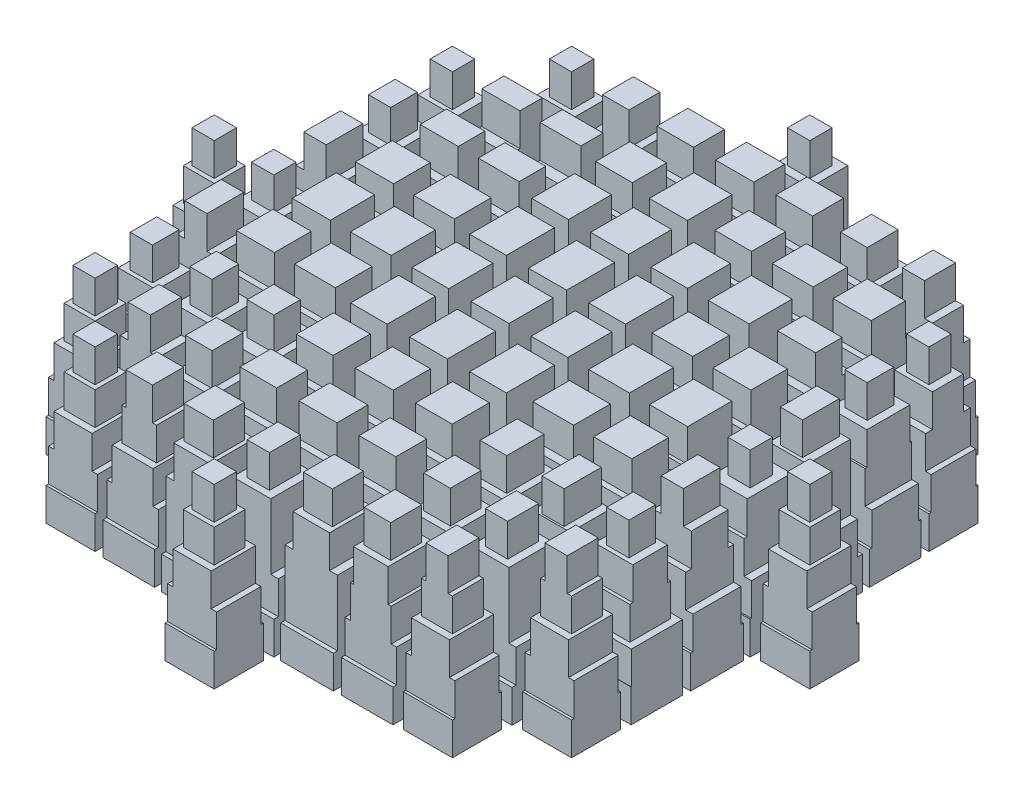
from build123d import *

# Parameters (mm, degrees)
SKETCH1_W           = 380.825028694
SKETCH1_H           = 380.825028694
SKETCH1_W_2         = 380.825028693
SKETCH1_H_2         = 380.825028693
SKETCH1_W_3         = 399.946277384
SKETCH1_H_3         = 399.946277384
SKETCH1_W_4         = 407.866774554
SKETCH1_H_4         = 407.866774554
SKETCH1_W_5         = 413.062739116
SKETCH1_H_5         = 413.062739116
SKETCH1_W_6         = 405.243809891
SKETCH1_H_6         = 405.243809891
SKETCH1_W_7         = 420.736387109
SKETCH1_H_7         = 420.736387109
SKETCH1_W_8         = 430.755323543
SKETCH1_H_8         = 430.755323543
SKETCH1_W_9         = 435.678401371
SKETCH1_H_9         = 435.678401372
SKETCH1_W_10        = 438.119195827
SKETCH1_H_10        = 438.119195827
SKETCH1_W_11        = 447.749339557
SKETCH1_H_11        = 447.749339558
SKETCH1_H_12        = 450.124684288
SKETCH1_W_12        = 447.749339558
SKETCH1_H_13        = 447.749339557
SKETCH1_W_13        = 454.838160301
SKETCH1_H_14        = 454.838160301
SKETCH1_W_14        = 459.503289136
SKETCH1_H_15        = 459.503289136
SKETCH1_W_15        = 435.678401372
SKETCH1_H_16        = 435.678401371
SKETCH1_W_16        = 450.124684288
BOSS_EXTRUDE1_DEPTH = 254
SKETCH2_W           = 380.825028694
SKETCH2_H           = 342.493530132
SKETCH2_W_2         = 380.825028693
SKETCH2_H_2         = 342.493530131
SKETCH2_W_3         = 399.946277384
SKETCH2_H_3         = 287.011536961
SKETCH2_W_4         = 407.866774554
SKETCH2_H_4         = 372.329721467
SKETCH2_W_5         = 413.062739116
SKETCH2_H_5         = 333.608219418
SKETCH2_H_6         = 345.999684769
SKETCH2_W_6         = 405.243809891
SKETCH2_W_7         = 420.736387109
SKETCH2_H_7         = 396.170115437
SKETCH2_W_8         = 430.755323543
SKETCH2_W_9         = 435.678401371
SKETCH2_H_8         = 343.027544271
SKETCH2_W_10        = 438.119195827
SKETCH2_W_11        = 447.749339557
SKETCH2_H_9         = 450.124684288
SKETCH2_H_10        = 447.749339558
SKETCH2_W_12        = 447.749339558
SKETCH2_W_13        = 454.838160301
SKETCH2_W_14        = 459.503289136
SKETCH2_H_11        = 440.990348319
SKETCH2_W_15        = 435.678401372
SKETCH2_W_16        = 450.124684288
SKETCH2_H_12        = 425.775325846
SKETCH2_H_13        = 459.503289136
SKETCH2_H_14        = 375.365303994
SKETCH2_H_15        = 423.263355098
SKETCH2_H_16        = 413.062739116
SKETCH2_H_17        = 409.981511306
SKETCH2_H_18        = 392.971779508
SKETCH2_H_19        = 429.929738033
SKETCH2_H_20        = 332.235530386
SKETCH2_H_21        = 360.691530487
BOSS_EXTRUDE2_DEPTH = 254
SKETCH3_W           = 295.707919328
SKETCH3_H           = 342.493530132
SKETCH3_W_2         = 295.707919329
SKETCH3_H_2         = 342.493530131
SKETCH3_H_3         = 316.606594273
SKETCH3_H_4         = 372.329721467
SKETCH3_H_5         = 333.608219418
SKETCH3_H_6         = 345.999684769
SKETCH3_H_7         = 343.027544271
SKETCH3_W_3         = 316.606594273
SKETCH3_H_8         = 396.170115437
SKETCH3_W_4         = 407.866774554
SKETCH3_W_5         = 450.124684288
SKETCH3_H_9         = 425.775325846
SKETCH3_H_10        = 295.707919328
SKETCH3_H_11        = 423.263355098
SKETCH3_H_12        = 413.062739116
SKETCH3_H_13        = 409.981511306
SKETCH3_H_14        = 392.971779508
SKETCH3_H_15        = 332.235530386
SKETCH3_H_16        = 360.691530487
BOSS_EXTRUDE3_DEPTH = 254
SKETCH4_W           = 239.96776643
SKETCH4_H           = 239.96776643
SKETCH4_H_2         = 239.967766431
SKETCH4_W_2         = 295.707919329
SKETCH4_H_3         = 269.283960235
SKETCH4_H_4         = 284.683846682
SKETCH4_H_5         = 342.493530132
SKETCH4_H_6         = 333.608219418
SKETCH4_W_3         = 239.967766431
SKETCH4_H_7         = 316.606594273
SKETCH4_H_8         = 372.329721467
SKETCH4_H_9         = 345.999684769
SKETCH4_W_4         = 269.283960235
SKETCH4_W_5         = 316.606594273
SKETCH4_H_10        = 342.493530131
SKETCH4_H_11        = 396.170115437
SKETCH4_W_6         = 284.683846682
SKETCH4_H_12        = 343.027544271
SKETCH4_W_7         = 295.707919328
SKETCH4_H_13        = 295.707919328
SKETCH4_H_14        = 413.062739116
SKETCH4_H_15        = 392.971779508
SKETCH4_H_16        = 332.235530386
BOSS_EXTRUDE4_DEPTH = 254
SKETCH5_W           = 172.796541134
SKETCH5_H           = 172.796541134
SKETCH5_W_2         = 172.796541135
SKETCH5_H_2         = 172.796541135
SKETCH5_H_3         = 206.531369558
SKETCH5_H_4         = 284.683846682
SKETCH5_H_5         = 239.967766431
SKETCH5_W_3         = 295.707919329
SKETCH5_H_6         = 342.493530132
SKETCH5_W_4         = 206.531369558
SKETCH5_H_7         = 239.96776643
SKETCH5_W_5         = 316.606594273
SKETCH5_W_6         = 226.243779879
SKETCH5_W_7         = 284.683846682
SKETCH5_H_8         = 288.405362108
SKETCH5_H_9         = 372.329721467
SKETCH5_H_10        = 333.608219418
SKETCH5_H_11        = 265.294347677
SKETCH5_W_8         = 295.707919328
SKETCH5_H_12        = 345.999684769
BOSS_EXTRUDE5_DEPTH = 254
SCALE1_SCALE        = 0.025


with BuildPart() as part:
    # Sketch1 → Boss-Extrude1 (new body)
    with BuildSketch(Plane(origin=(0, 0, 0), x_dir=(1, 0, 0), z_dir=(0, 1, 0))):
        with Locations((-2309.090909091, 0)):
            Rectangle(SKETCH1_W, SKETCH1_H)
        with Locations((-1847.272727273, -1385.454545455)):
            Rectangle(SKETCH1_W_2, SKETCH1_H_2)
        with Locations((-1847.272727273, -923.636363636)):
            Rectangle(SKETCH1_W_3, SKETCH1_H_3)
        with Locations((-1847.272727273, -461.818181818)):
            Rectangle(SKETCH1_W_4, SKETCH1_H_4)
        with Locations((-1847.272727273, 0)):
            Rectangle(SKETCH1_W_5, SKETCH1_H_5)
        with Locations((-1847.272727273, 461.818181818)):
            Rectangle(SKETCH1_W_4, SKETCH1_H_4)
        with Locations((-1847.272727273, 923.636363636)):
            Rectangle(SKETCH1_W_3, SKETCH1_H_3)
        with Locations((-1847.272727273, 1385.454545455)):
            Rectangle(SKETCH1_W_2, SKETCH1_H_2)
        with Locations((-1385.454545455, -1847.272727273)):
            Rectangle(SKETCH1_W_2, SKETCH1_H_2)
        with Locations((-1385.454545455, -1385.454545455)):
            Rectangle(SKETCH1_W_6, SKETCH1_H_6)
        with Locations((-1385.454545455, -923.636363637)):
            Rectangle(SKETCH1_W_7, SKETCH1_H_7)
        with Locations((-1385.454545455, -461.818181819)):
            Rectangle(SKETCH1_W_8, SKETCH1_H_8)
        with Locations((-1385.454545455, 0)):
            Rectangle(SKETCH1_W_9, SKETCH1_H_9)
        with Locations((-1385.454545455, 461.818181819)):
            Rectangle(SKETCH1_W_8, SKETCH1_H_8)
        with Locations((-1385.454545455, 923.636363637)):
            Rectangle(SKETCH1_W_7, SKETCH1_H_7)
        with Locations((-1385.454545455, 1385.454545455)):
            Rectangle(SKETCH1_W_6, SKETCH1_H_6)
        with Locations((-1385.454545455, 1847.272727273)):
            Rectangle(SKETCH1_W_2, SKETCH1_H_2)
        with Locations((-923.636363636, -1847.272727273)):
            Rectangle(SKETCH1_W_3, SKETCH1_H_3)
        with Locations((-923.636363637, -1385.454545455)):
            Rectangle(SKETCH1_W_7, SKETCH1_H_7)
        with Locations((-923.636363636, -923.636363636)):
            Rectangle(SKETCH1_W_10, SKETCH1_H_10)
        with Locations((-923.636363637, -461.818181818)):
            Rectangle(SKETCH1_W_11, SKETCH1_H_11)
        with Locations((-923.636363637, 0)):
            Rectangle(SKETCH1_W_11, SKETCH1_H_12)
        with Locations((-923.636363637, 461.818181818)):
            Rectangle(SKETCH1_W_11, SKETCH1_H_11)
        with Locations((-923.636363636, 923.636363636)):
            Rectangle(SKETCH1_W_10, SKETCH1_H_10)
        with Locations((-923.636363637, 1385.454545455)):
            Rectangle(SKETCH1_W_7, SKETCH1_H_7)
        with Locations((-923.636363636, 1847.272727273)):
            Rectangle(SKETCH1_W_3, SKETCH1_H_3)
        with Locations((-461.818181818, -1847.272727273)):
            Rectangle(SKETCH1_W_4, SKETCH1_H_4)
        with Locations((-461.818181819, -1385.454545455)):
            Rectangle(SKETCH1_W_8, SKETCH1_H_8)
        with Locations((-461.818181818, -923.636363637)):
            Rectangle(SKETCH1_W_12, SKETCH1_H_13)
        with Locations((-461.818181819, -461.818181819)):
            Rectangle(SKETCH1_W_13, SKETCH1_H_14)
        with Locations((-461.818181818, 0)):
            Rectangle(SKETCH1_W_14, SKETCH1_H_15)
        with Locations((-461.818181819, 461.818181819)):
            Rectangle(SKETCH1_W_13, SKETCH1_H_14)
        with Locations((-461.818181818, 923.636363637)):
            Rectangle(SKETCH1_W_12, SKETCH1_H_13)
        with Locations((-461.818181819, 1385.454545455)):
            Rectangle(SKETCH1_W_8, SKETCH1_H_8)
        with Locations((-461.818181818, 1847.272727273)):
            Rectangle(SKETCH1_W_4, SKETCH1_H_4)
        with Locations((0, -2309.090909091)):
            Rectangle(SKETCH1_W, SKETCH1_H)
        with Locations((0, -1847.272727273)):
            Rectangle(SKETCH1_W_5, SKETCH1_H_5)
        with Locations((0, -1385.454545455)):
            Rectangle(SKETCH1_W_15, SKETCH1_H_16)
        with Locations((0, -923.636363637)):
            Rectangle(SKETCH1_W_16, SKETCH1_H_13)
        with Locations((0, -461.818181818)):
            Rectangle(SKETCH1_W_14, SKETCH1_H_15)
        Rectangle(SKETCH1_W_14, SKETCH1_H_15)
        with Locations((0, 461.818181818)):
            Rectangle(SKETCH1_W_14, SKETCH1_H_15)
        with Locations((0, 923.636363637)):
            Rectangle(SKETCH1_W_16, SKETCH1_H_13)
        with Locations((0, 1385.454545455)):
            Rectangle(SKETCH1_W_15, SKETCH1_H_16)
        with Locations((0, 1847.272727273)):
            Rectangle(SKETCH1_W_5, SKETCH1_H_5)
        with Locations((0, 2309.090909091)):
            Rectangle(SKETCH1_W, SKETCH1_H)
        with Locations((461.818181818, -1847.272727273)):
            Rectangle(SKETCH1_W_4, SKETCH1_H_4)
        with Locations((461.818181819, -1385.454545455)):
            Rectangle(SKETCH1_W_8, SKETCH1_H_8)
        with Locations((461.818181818, -923.636363637)):
            Rectangle(SKETCH1_W_12, SKETCH1_H_13)
        with Locations((461.818181819, -461.818181819)):
            Rectangle(SKETCH1_W_13, SKETCH1_H_14)
        with Locations((461.818181818, 0)):
            Rectangle(SKETCH1_W_14, SKETCH1_H_15)
        with Locations((461.818181819, 461.818181819)):
            Rectangle(SKETCH1_W_13, SKETCH1_H_14)
        with Locations((461.818181818, 923.636363637)):
            Rectangle(SKETCH1_W_12, SKETCH1_H_13)
        with Locations((461.818181819, 1385.454545455)):
            Rectangle(SKETCH1_W_8, SKETCH1_H_8)
        with Locations((461.818181818, 1847.272727273)):
            Rectangle(SKETCH1_W_4, SKETCH1_H_4)
        with Locations((923.636363636, -1847.272727273)):
            Rectangle(SKETCH1_W_3, SKETCH1_H_3)
        with Locations((923.636363637, -1385.454545455)):
            Rectangle(SKETCH1_W_7, SKETCH1_H_7)
        with Locations((923.636363636, -923.636363636)):
            Rectangle(SKETCH1_W_10, SKETCH1_H_10)
        with Locations((923.636363637, -461.818181818)):
            Rectangle(SKETCH1_W_11, SKETCH1_H_11)
        with Locations((923.636363637, 0)):
            Rectangle(SKETCH1_W_11, SKETCH1_H_12)
        with Locations((923.636363637, 461.818181818)):
            Rectangle(SKETCH1_W_11, SKETCH1_H_11)
        with Locations((923.636363636, 923.636363636)):
            Rectangle(SKETCH1_W_10, SKETCH1_H_10)
        with Locations((923.636363637, 1385.454545455)):
            Rectangle(SKETCH1_W_7, SKETCH1_H_7)
        with Locations((923.636363636, 1847.272727273)):
            Rectangle(SKETCH1_W_3, SKETCH1_H_3)
        with Locations((1385.454545455, -1847.272727273)):
            Rectangle(SKETCH1_W_2, SKETCH1_H_2)
        with Locations((1385.454545455, -1385.454545455)):
            Rectangle(SKETCH1_W_6, SKETCH1_H_6)
        with Locations((1385.454545455, -923.636363637)):
            Rectangle(SKETCH1_W_7, SKETCH1_H_7)
        with Locations((1385.454545455, -461.818181819)):
            Rectangle(SKETCH1_W_8, SKETCH1_H_8)
        with Locations((1385.454545455, 0)):
            Rectangle(SKETCH1_W_9, SKETCH1_H_9)
        with Locations((1385.454545455, 461.818181819)):
            Rectangle(SKETCH1_W_8, SKETCH1_H_8)
        with Locations((1385.454545455, 923.636363637)):
            Rectangle(SKETCH1_W_7, SKETCH1_H_7)
        with Locations((1385.454545455, 1385.454545455)):
            Rectangle(SKETCH1_W_6, SKETCH1_H_6)
        with Locations((1385.454545455, 1847.272727273)):
            Rectangle(SKETCH1_W_2, SKETCH1_H_2)
        with Locations((1847.272727273, -1385.454545455)):
            Rectangle(SKETCH1_W_2, SKETCH1_H_2)
        with Locations((1847.272727273, -923.636363636)):
            Rectangle(SKETCH1_W_3, SKETCH1_H_3)
        with Locations((1847.272727273, -461.818181818)):
            Rectangle(SKETCH1_W_4, SKETCH1_H_4)
        with Locations((1847.272727273, 0)):
            Rectangle(SKETCH1_W_5, SKETCH1_H_5)
        with Locations((1847.272727273, 461.818181818)):
            Rectangle(SKETCH1_W_4, SKETCH1_H_4)
        with Locations((1847.272727273, 923.636363636)):
            Rectangle(SKETCH1_W_3, SKETCH1_H_3)
        with Locations((1847.272727273, 1385.454545455)):
            Rectangle(SKETCH1_W_2, SKETCH1_H_2)
        with Locations((2309.090909091, 0)):
            Rectangle(SKETCH1_W, SKETCH1_H)
    extrude(amount=BOSS_EXTRUDE1_DEPTH)

    # Sketch2 → Boss-Extrude2 (add)
    with BuildSketch(Plane(origin=(0, 254, 0), x_dir=(1, 0, 0), z_dir=(0, 1, 0))):
        with Locations((-2309.090909091, 0)):
            Rectangle(SKETCH2_W, SKETCH2_H)
        with Locations((-1847.272727273, -1385.454545455)):
            Rectangle(SKETCH2_W_2, SKETCH2_H_2)
        with Locations((-1847.272727273, -923.636363637)):
            Rectangle(SKETCH2_W_3, SKETCH2_H_3)
        with Locations((-1847.272727273, -461.818181819)):
            Rectangle(SKETCH2_W_4, SKETCH2_H_4)
        with Locations((-1847.272727273, 0)):
            Rectangle(SKETCH2_W_5, SKETCH2_H)
        with Locations((-1847.272727273, 461.818181819)):
            Rectangle(SKETCH2_W_4, SKETCH2_H_4)
        with Locations((-1847.272727273, 923.636363636)):
            Rectangle(SKETCH2_W_3, SKETCH2_H_5)
        with Locations((-1847.272727273, 1385.454545455)):
            Rectangle(SKETCH2_W_2, SKETCH2_H_6)
        with Locations((-1385.454545455, -1847.272727273)):
            Rectangle(SKETCH2_W_2, SKETCH2_H_2)
        with Locations((-1385.454545455, -1385.454545455)):
            Rectangle(SKETCH2_W_6, SKETCH2_H_2)
        with Locations((-1385.454545455, -923.636363637)):
            Rectangle(SKETCH2_W_7, SKETCH2_H_7)
        with Locations((-1385.454545455, -461.818181819)):
            Rectangle(SKETCH2_W_8, SKETCH2_H_4)
        with Locations((-1385.454545455, 0)):
            Rectangle(SKETCH2_W_9, SKETCH2_H)
        with Locations((-1385.454545455, 461.818181819)):
            Rectangle(SKETCH2_W_8, SKETCH2_H_4)
        with Locations((-1385.454545455, 923.636363636)):
            Rectangle(SKETCH2_W_7, SKETCH2_H_5)
        with Locations((-1385.454545455, 1385.454545455)):
            Rectangle(SKETCH2_W_6, SKETCH2_H_6)
        with Locations((-1385.454545455, 1847.272727273)):
            Rectangle(SKETCH2_W_2, SKETCH2_H_8)
        with Locations((-923.636363636, -1847.272727273)):
            Rectangle(SKETCH2_W_3, SKETCH2_H_2)
        with Locations((-923.636363637, -1385.454545455)):
            Rectangle(SKETCH2_W_7, SKETCH2_H_2)
        with Locations((-923.636363636, -923.636363637)):
            Rectangle(SKETCH2_W_10, SKETCH2_H_7)
        with Locations((-923.636363637, -461.818181819)):
            Rectangle(SKETCH2_W_11, SKETCH2_H_4)
        with Locations((-923.636363637, 0)):
            Rectangle(SKETCH2_W_11, SKETCH2_H_9)
        with Locations((-923.636363637, 461.818181818)):
            Rectangle(SKETCH2_W_11, SKETCH2_H_10)
        with Locations((-923.636363636, 923.636363636)):
            Rectangle(SKETCH2_W_10, SKETCH2_H_5)
        with Locations((-923.636363637, 1385.454545455)):
            Rectangle(SKETCH2_W_7, SKETCH2_H_6)
        with Locations((-923.636363636, 1847.272727273)):
            Rectangle(SKETCH2_W_3, SKETCH2_H_8)
        with Locations((-461.818181818, -1847.272727273)):
            Rectangle(SKETCH2_W_4, SKETCH2_H_2)
        with Locations((-461.818181819, -1385.454545455)):
            Rectangle(SKETCH2_W_8, SKETCH2_H_2)
        with Locations((-461.818181818, -923.636363637)):
            Rectangle(SKETCH2_W_12, SKETCH2_H_7)
        with Locations((-461.818181819, -461.818181819)):
            Rectangle(SKETCH2_W_13, SKETCH2_H_4)
        with Locations((-461.818181818, 0)):
            Rectangle(SKETCH2_W_14, SKETCH2_H_9)
        with Locations((-461.818181819, 461.818181818)):
            Rectangle(SKETCH2_W_13, SKETCH2_H_10)
        with Locations((-461.818181818, 923.636363636)):
            Rectangle(SKETCH2_W_12, SKETCH2_H_11)
        with Locations((-461.818181819, 1385.454545455)):
            Rectangle(SKETCH2_W_8, SKETCH2_H_6)
        with Locations((-461.818181818, 1847.272727273)):
            Rectangle(SKETCH2_W_4, SKETCH2_H_8)
        with Locations((0, -2309.090909091)):
            Rectangle(SKETCH2_W, SKETCH2_H)
        with Locations((0, -1847.272727273)):
            Rectangle(SKETCH2_W_5, SKETCH2_H_2)
        with Locations((0, -1385.454545455)):
            Rectangle(SKETCH2_W_15, SKETCH2_H_2)
        with Locations((0, -923.636363637)):
            Rectangle(SKETCH2_W_16, SKETCH2_H_7)
        with Locations((0, -461.818181818)):
            Rectangle(SKETCH2_W_14, SKETCH2_H_12)
        Rectangle(SKETCH2_W_14, SKETCH2_H_9)
        with Locations((0, 461.818181818)):
            Rectangle(SKETCH2_W_14, SKETCH2_H_13)
        with Locations((0, 923.636363636)):
            Rectangle(SKETCH2_W_16, SKETCH2_H_11)
        with Locations((0, 1385.454545455)):
            Rectangle(SKETCH2_W_15, SKETCH2_H_6)
        with Locations((0, 1847.272727273)):
            Rectangle(SKETCH2_W_5, SKETCH2_H_8)
        with Locations((0, 2309.090909091)):
            Rectangle(SKETCH2_W, SKETCH2_H_14)
        with Locations((461.818181818, -1847.272727273)):
            Rectangle(SKETCH2_W_4, SKETCH2_H_2)
        with Locations((461.818181819, -1385.454545455)):
            Rectangle(SKETCH2_W_8, SKETCH2_H_2)
        with Locations((461.818181818, -923.636363637)):
            Rectangle(SKETCH2_W_12, SKETCH2_H_7)
        with Locations((461.818181819, -461.818181818)):
            Rectangle(SKETCH2_W_13, SKETCH2_H_12)
        with Locations((461.818181818, 0)):
            Rectangle(SKETCH2_W_14, SKETCH2_H_9)
        with Locations((461.818181819, 461.818181818)):
            Rectangle(SKETCH2_W_13, SKETCH2_H_15)
        with Locations((461.818181818, 923.636363636)):
            Rectangle(SKETCH2_W_12, SKETCH2_H_11)
        with Locations((461.818181819, 1385.454545455)):
            Rectangle(SKETCH2_W_8, SKETCH2_H_6)
        with Locations((461.818181818, 1847.272727273)):
            Rectangle(SKETCH2_W_4, SKETCH2_H_8)
        with Locations((923.636363636, -1847.272727273)):
            Rectangle(SKETCH2_W_3, SKETCH2_H_2)
        with Locations((923.636363637, -1385.454545455)):
            Rectangle(SKETCH2_W_7, SKETCH2_H_2)
        with Locations((923.636363636, -923.636363637)):
            Rectangle(SKETCH2_W_10, SKETCH2_H_7)
        with Locations((923.636363637, -461.818181818)):
            Rectangle(SKETCH2_W_11, SKETCH2_H_16)
        with Locations((923.636363637, 0)):
            Rectangle(SKETCH2_W_11, SKETCH2_H_9)
        with Locations((923.636363637, 461.818181818)):
            Rectangle(SKETCH2_W_11, SKETCH2_H_10)
        with Locations((923.636363636, 923.636363636)):
            Rectangle(SKETCH2_W_10, SKETCH2_H_17)
        with Locations((923.636363637, 1385.454545455)):
            Rectangle(SKETCH2_W_7, SKETCH2_H_6)
        with Locations((923.636363636, 1847.272727273)):
            Rectangle(SKETCH2_W_3, SKETCH2_H_8)
        with Locations((1385.454545455, -1847.272727273)):
            Rectangle(SKETCH2_W_2, SKETCH2_H_2)
        with Locations((1385.454545455, -1385.454545455)):
            Rectangle(SKETCH2_W_6, SKETCH2_H_2)
        with Locations((1385.454545455, -923.636363637)):
            Rectangle(SKETCH2_W_7, SKETCH2_H_7)
        with Locations((1385.454545455, -461.818181818)):
            Rectangle(SKETCH2_W_8, SKETCH2_H_16)
        with Locations((1385.454545455, 0)):
            Rectangle(SKETCH2_W_9, SKETCH2_H_18)
        with Locations((1385.454545455, 461.818181819)):
            Rectangle(SKETCH2_W_8, SKETCH2_H_19)
        with Locations((1385.454545455, 923.636363636)):
            Rectangle(SKETCH2_W_7, SKETCH2_H_17)
        with Locations((1385.454545455, 1385.454545455)):
            Rectangle(SKETCH2_W_6, SKETCH2_H_6)
        with Locations((1385.454545455, 1847.272727273)):
            Rectangle(SKETCH2_W_2, SKETCH2_H_8)
        with Locations((1847.272727273, -1385.454545455)):
            Rectangle(SKETCH2_W_2, SKETCH2_H_2)
        with Locations((1847.272727273, -923.636363637)):
            Rectangle(SKETCH2_W_3, SKETCH2_H_7)
        with Locations((1847.272727273, -461.818181819)):
            Rectangle(SKETCH2_W_4, SKETCH2_H_4)
        with Locations((1847.272727273, 0)):
            Rectangle(SKETCH2_W_5, SKETCH2_H_18)
        with Locations((1847.272727273, 461.818181818)):
            Rectangle(SKETCH2_W_4, SKETCH2_H_20)
        with Locations((1847.272727273, 923.636363637)):
            Rectangle(SKETCH2_W_3, SKETCH2_H_21)
        with Locations((1847.272727273, 1385.454545455)):
            Rectangle(SKETCH2_W_2, SKETCH2_H_6)
        with Locations((2309.090909091, 0)):
            Rectangle(SKETCH2_W, SKETCH2_H)
    extrude(amount=BOSS_EXTRUDE2_DEPTH)

    # Sketch3 → Boss-Extrude3 (add)
    with BuildSketch(Plane(origin=(0, 508, 0), x_dir=(1, 0, 0), z_dir=(0, 1, 0))):
        with Locations((-2309.090909091, 0)):
            Rectangle(SKETCH3_W, SKETCH3_H)
        with Locations((-1847.272727273, -1385.454545455)):
            Rectangle(SKETCH3_W_2, SKETCH3_H_2)
        with Locations((-1847.272727273, -923.636363637)):
            Rectangle(SKETCH3_W_2, SKETCH3_H_3)
        with Locations((-1847.272727273, -461.818181819)):
            Rectangle(SKETCH3_W_2, SKETCH3_H_4)
        with Locations((-1847.272727273, 0)):
            Rectangle(SKETCH3_W_2, SKETCH3_H)
        with Locations((-1847.272727273, 461.818181819)):
            Rectangle(SKETCH3_W_2, SKETCH3_H_4)
        with Locations((-1847.272727273, 923.636363636)):
            Rectangle(SKETCH3_W_2, SKETCH3_H_5)
        with Locations((-1847.272727273, 1385.454545455)):
            Rectangle(SKETCH3_W_2, SKETCH3_H_6)
        with Locations((-1385.454545455, -1847.272727273)):
            Rectangle(SKETCH3_W_2, SKETCH3_H_2)
        with Locations((-1385.454545455, -1385.454545455)):
            Rectangle(SKETCH3_W_2, SKETCH3_H_2)
        with Locations((-1385.454545455, -923.636363637)):
            Rectangle(SKETCH3_W_2, SKETCH3_H_3)
        with Locations((-1385.454545455, -461.818181819)):
            Rectangle(SKETCH3_W_2, SKETCH3_H_4)
        with Locations((-1385.454545455, 0)):
            Rectangle(SKETCH3_W_2, SKETCH3_H)
        with Locations((-1385.454545455, 461.818181819)):
            Rectangle(SKETCH3_W_2, SKETCH3_H_4)
        with Locations((-1385.454545455, 923.636363636)):
            Rectangle(SKETCH3_W_2, SKETCH3_H_5)
        with Locations((-1385.454545455, 1385.454545455)):
            Rectangle(SKETCH3_W_2, SKETCH3_H_6)
        with Locations((-1385.454545455, 1847.272727273)):
            Rectangle(SKETCH3_W_2, SKETCH3_H_7)
        with Locations((-923.636363637, -1847.272727273)):
            Rectangle(SKETCH3_W_3, SKETCH3_H_2)
        with Locations((-923.636363637, -1385.454545455)):
            Rectangle(SKETCH3_W_3, SKETCH3_H_2)
        with Locations((-923.636363637, -923.636363637)):
            Rectangle(SKETCH3_W_3, SKETCH3_H_8)
        with Locations((-923.636363637, -461.818181819)):
            Rectangle(SKETCH3_W_3, SKETCH3_H_4)
        with Locations((-923.636363637, 0)):
            Rectangle(SKETCH3_W_3, SKETCH3_H)
        with Locations((-923.636363637, 461.818181819)):
            Rectangle(SKETCH3_W_3, SKETCH3_H_4)
        with Locations((-923.636363637, 923.636363636)):
            Rectangle(SKETCH3_W_3, SKETCH3_H_5)
        with Locations((-923.636363637, 1385.454545455)):
            Rectangle(SKETCH3_W_3, SKETCH3_H_6)
        with Locations((-923.636363637, 1847.272727273)):
            Rectangle(SKETCH3_W_3, SKETCH3_H_7)
        with Locations((-461.818181818, -1847.272727273)):
            Rectangle(SKETCH3_W_4, SKETCH3_H_2)
        with Locations((-461.818181818, -1385.454545455)):
            Rectangle(SKETCH3_W_4, SKETCH3_H_2)
        with Locations((-461.818181818, -923.636363637)):
            Rectangle(SKETCH3_W_4, SKETCH3_H_8)
        with Locations((-461.818181818, -461.818181819)):
            Rectangle(SKETCH3_W_4, SKETCH3_H_4)
        with Locations((-461.818181818, 0)):
            Rectangle(SKETCH3_W_4, SKETCH3_H)
        with Locations((-461.818181818, 461.818181819)):
            Rectangle(SKETCH3_W_4, SKETCH3_H_4)
        with Locations((-461.818181818, 923.636363636)):
            Rectangle(SKETCH3_W_4, SKETCH3_H_5)
        with Locations((-461.818181818, 1385.454545455)):
            Rectangle(SKETCH3_W_4, SKETCH3_H_6)
        with Locations((-461.818181818, 1847.272727273)):
            Rectangle(SKETCH3_W_4, SKETCH3_H_7)
        with Locations((0, -2309.090909091)):
            Rectangle(SKETCH3_W, SKETCH3_H)
        with Locations((0, -1847.272727273)):
            Rectangle(SKETCH3_W, SKETCH3_H_2)
        with Locations((0, -1385.454545455)):
            Rectangle(SKETCH3_W, SKETCH3_H_2)
        with Locations((0, -923.636363637)):
            Rectangle(SKETCH3_W_5, SKETCH3_H_8)
        with Locations((0, -461.818181818)):
            Rectangle(SKETCH3_W_5, SKETCH3_H_9)
        Rectangle(SKETCH3_W_5, SKETCH3_H)
        with Locations((0, 461.818181819)):
            Rectangle(SKETCH3_W_5, SKETCH3_H_4)
        with Locations((0, 923.636363636)):
            Rectangle(SKETCH3_W_5, SKETCH3_H_5)
        with Locations((0, 1385.454545455)):
            Rectangle(SKETCH3_W, SKETCH3_H_6)
        with Locations((0, 1847.272727273)):
            Rectangle(SKETCH3_W, SKETCH3_H_7)
        with Locations((0, 2309.090909091)):
            Rectangle(SKETCH3_W, SKETCH3_H_10)
        with Locations((461.818181818, -1847.272727273)):
            Rectangle(SKETCH3_W_4, SKETCH3_H_2)
        with Locations((461.818181818, -1385.454545455)):
            Rectangle(SKETCH3_W_4, SKETCH3_H_2)
        with Locations((461.818181818, -923.636363637)):
            Rectangle(SKETCH3_W_4, SKETCH3_H_8)
        with Locations((461.818181818, -461.818181818)):
            Rectangle(SKETCH3_W_4, SKETCH3_H_9)
        with Locations((461.818181818, 0)):
            Rectangle(SKETCH3_W_4, SKETCH3_H)
        with Locations((461.818181818, 461.818181818)):
            Rectangle(SKETCH3_W_4, SKETCH3_H_11)
        with Locations((461.818181818, 923.636363636)):
            Rectangle(SKETCH3_W_4, SKETCH3_H_5)
        with Locations((461.818181818, 1385.454545455)):
            Rectangle(SKETCH3_W_4, SKETCH3_H_6)
        with Locations((461.818181818, 1847.272727273)):
            Rectangle(SKETCH3_W_4, SKETCH3_H_7)
        with Locations((923.636363637, -1847.272727273)):
            Rectangle(SKETCH3_W_3, SKETCH3_H_2)
        with Locations((923.636363637, -1385.454545455)):
            Rectangle(SKETCH3_W_3, SKETCH3_H_2)
        with Locations((923.636363637, -923.636363637)):
            Rectangle(SKETCH3_W_3, SKETCH3_H_8)
        with Locations((923.636363637, -461.818181818)):
            Rectangle(SKETCH3_W_3, SKETCH3_H_12)
        with Locations((923.636363637, 0)):
            Rectangle(SKETCH3_W_3, SKETCH3_H)
        with Locations((923.636363637, 461.818181818)):
            Rectangle(SKETCH3_W_3, SKETCH3_H_11)
        with Locations((923.636363637, 923.636363636)):
            Rectangle(SKETCH3_W_3, SKETCH3_H_13)
        with Locations((923.636363637, 1385.454545455)):
            Rectangle(SKETCH3_W_3, SKETCH3_H_6)
        with Locations((923.636363637, 1847.272727273)):
            Rectangle(SKETCH3_W_3, SKETCH3_H_7)
        with Locations((1385.454545455, -1847.272727273)):
            Rectangle(SKETCH3_W_2, SKETCH3_H_2)
        with Locations((1385.454545455, -1385.454545455)):
            Rectangle(SKETCH3_W_2, SKETCH3_H_2)
        with Locations((1385.454545455, -923.636363637)):
            Rectangle(SKETCH3_W_2, SKETCH3_H_8)
        with Locations((1385.454545455, -461.818181818)):
            Rectangle(SKETCH3_W_2, SKETCH3_H_12)
        with Locations((1385.454545455, 0)):
            Rectangle(SKETCH3_W_2, SKETCH3_H_14)
        with Locations((1385.454545455, 461.818181818)):
            Rectangle(SKETCH3_W_2, SKETCH3_H_11)
        with Locations((1385.454545455, 923.636363636)):
            Rectangle(SKETCH3_W_2, SKETCH3_H_13)
        with Locations((1385.454545455, 1385.454545455)):
            Rectangle(SKETCH3_W_2, SKETCH3_H_6)
        with Locations((1385.454545455, 1847.272727273)):
            Rectangle(SKETCH3_W_2, SKETCH3_H_7)
        with Locations((1847.272727273, -1385.454545455)):
            Rectangle(SKETCH3_W_2, SKETCH3_H_2)
        with Locations((1847.272727273, -923.636363637)):
            Rectangle(SKETCH3_W_2, SKETCH3_H_3)
        with Locations((1847.272727273, -461.818181819)):
            Rectangle(SKETCH3_W_2, SKETCH3_H_4)
        with Locations((1847.272727273, 0)):
            Rectangle(SKETCH3_W_2, SKETCH3_H_14)
        with Locations((1847.272727273, 461.818181818)):
            Rectangle(SKETCH3_W_2, SKETCH3_H_15)
        with Locations((1847.272727273, 923.636363637)):
            Rectangle(SKETCH3_W_2, SKETCH3_H_16)
        with Locations((1847.272727273, 1385.454545455)):
            Rectangle(SKETCH3_W_2, SKETCH3_H_6)
        with Locations((2309.090909091, 0)):
            Rectangle(SKETCH3_W, SKETCH3_H)
    extrude(amount=BOSS_EXTRUDE3_DEPTH)

    # Sketch4 → Boss-Extrude4 (add)
    with BuildSketch(Plane(origin=(0, 762, 0), x_dir=(1, 0, 0), z_dir=(0, 1, 0))):
        with Locations((-2309.090909091, 0)):
            Rectangle(SKETCH4_W, SKETCH4_H)
        with Locations((-1847.272727273, -1385.454545455)):
            Rectangle(SKETCH4_W, SKETCH4_H_2)
        with Locations((-1847.272727273, -923.636363637)):
            Rectangle(SKETCH4_W_2, SKETCH4_H_3)
        with Locations((-1847.272727273, -461.818181818)):
            Rectangle(SKETCH4_W_2, SKETCH4_H_4)
        with Locations((-1847.272727273, 0)):
            Rectangle(SKETCH4_W_2, SKETCH4_H_5)
        with Locations((-1847.272727273, 461.818181818)):
            Rectangle(SKETCH4_W_2, SKETCH4_H_4)
        with Locations((-1847.272727273, 923.636363636)):
            Rectangle(SKETCH4_W_2, SKETCH4_H_6)
        with Locations((-1847.272727273, 1385.454545455)):
            Rectangle(SKETCH4_W_2, SKETCH4_H_2)
        with Locations((-1385.454545455, -1847.272727273)):
            Rectangle(SKETCH4_W_3, SKETCH4_H)
        with Locations((-1385.454545455, -1385.454545455)):
            Rectangle(SKETCH4_W_2, SKETCH4_H_2)
        with Locations((-1385.454545455, -923.636363637)):
            Rectangle(SKETCH4_W_2, SKETCH4_H_7)
        with Locations((-1385.454545455, -461.818181819)):
            Rectangle(SKETCH4_W_2, SKETCH4_H_8)
        with Locations((-1385.454545455, 0)):
            Rectangle(SKETCH4_W_2, SKETCH4_H_5)
        with Locations((-1385.454545455, 461.818181819)):
            Rectangle(SKETCH4_W_2, SKETCH4_H_8)
        with Locations((-1385.454545455, 923.636363636)):
            Rectangle(SKETCH4_W_2, SKETCH4_H_6)
        with Locations((-1385.454545455, 1385.454545455)):
            Rectangle(SKETCH4_W_2, SKETCH4_H_9)
        with Locations((-1385.454545455, 1847.272727273)):
            Rectangle(SKETCH4_W_2, SKETCH4_H)
        with Locations((-923.636363637, -1847.272727273)):
            Rectangle(SKETCH4_W_4, SKETCH4_H)
        with Locations((-923.636363637, -1385.454545455)):
            Rectangle(SKETCH4_W_5, SKETCH4_H_10)
        with Locations((-923.636363637, -923.636363637)):
            Rectangle(SKETCH4_W_5, SKETCH4_H_11)
        with Locations((-923.636363637, -461.818181819)):
            Rectangle(SKETCH4_W_5, SKETCH4_H_8)
        with Locations((-923.636363637, 0)):
            Rectangle(SKETCH4_W_5, SKETCH4_H_5)
        with Locations((-923.636363637, 461.818181819)):
            Rectangle(SKETCH4_W_5, SKETCH4_H_8)
        with Locations((-923.636363637, 923.636363636)):
            Rectangle(SKETCH4_W_5, SKETCH4_H_6)
        with Locations((-923.636363637, 1385.454545455)):
            Rectangle(SKETCH4_W_5, SKETCH4_H_9)
        with Locations((-923.636363637, 1847.272727273)):
            Rectangle(SKETCH4_W_5, SKETCH4_H)
        with Locations((-461.818181818, -1847.272727273)):
            Rectangle(SKETCH4_W_6, SKETCH4_H_10)
        with Locations((-461.818181818, -1385.454545455)):
            Rectangle(SKETCH4_W_6, SKETCH4_H_10)
        with Locations((-461.818181818, -923.636363637)):
            Rectangle(SKETCH4_W_6, SKETCH4_H_11)
        with Locations((-461.818181818, -461.818181819)):
            Rectangle(SKETCH4_W_6, SKETCH4_H_8)
        with Locations((-461.818181818, 0)):
            Rectangle(SKETCH4_W_6, SKETCH4_H_5)
        with Locations((-461.818181818, 461.818181819)):
            Rectangle(SKETCH4_W_6, SKETCH4_H_8)
        with Locations((-461.818181818, 923.636363636)):
            Rectangle(SKETCH4_W_6, SKETCH4_H_6)
        with Locations((-461.818181818, 1385.454545455)):
            Rectangle(SKETCH4_W_6, SKETCH4_H_9)
        with Locations((-461.818181818, 1847.272727273)):
            Rectangle(SKETCH4_W_6, SKETCH4_H_12)
        with Locations((0, -2309.090909091)):
            Rectangle(SKETCH4_W, SKETCH4_H)
        with Locations((0, -1847.272727273)):
            Rectangle(SKETCH4_W_7, SKETCH4_H_10)
        with Locations((0, -1385.454545455)):
            Rectangle(SKETCH4_W_7, SKETCH4_H_10)
        with Locations((0, -923.636363637)):
            Rectangle(SKETCH4_W_7, SKETCH4_H_11)
        with Locations((0, -461.818181819)):
            Rectangle(SKETCH4_W_7, SKETCH4_H_8)
        Rectangle(SKETCH4_W_7, SKETCH4_H_5)
        with Locations((0, 461.818181819)):
            Rectangle(SKETCH4_W_7, SKETCH4_H_8)
        with Locations((0, 923.636363636)):
            Rectangle(SKETCH4_W_7, SKETCH4_H_6)
        with Locations((0, 1385.454545455)):
            Rectangle(SKETCH4_W_7, SKETCH4_H_9)
        with Locations((0, 1847.272727273)):
            Rectangle(SKETCH4_W_7, SKETCH4_H_12)
        with Locations((0, 2309.090909091)):
            Rectangle(SKETCH4_W_7, SKETCH4_H_13)
        with Locations((461.818181818, -1847.272727273)):
            Rectangle(SKETCH4_W_6, SKETCH4_H_10)
        with Locations((461.818181818, -1385.454545455)):
            Rectangle(SKETCH4_W_6, SKETCH4_H_10)
        with Locations((461.818181818, -923.636363637)):
            Rectangle(SKETCH4_W_6, SKETCH4_H_11)
        with Locations((461.818181818, -461.818181819)):
            Rectangle(SKETCH4_W_6, SKETCH4_H_8)
        with Locations((461.818181818, 0)):
            Rectangle(SKETCH4_W_6, SKETCH4_H_5)
        with Locations((461.818181818, 461.818181819)):
            Rectangle(SKETCH4_W_6, SKETCH4_H_8)
        with Locations((461.818181818, 923.636363636)):
            Rectangle(SKETCH4_W_6, SKETCH4_H_6)
        with Locations((461.818181818, 1385.454545455)):
            Rectangle(SKETCH4_W_6, SKETCH4_H_9)
        with Locations((461.818181818, 1847.272727273)):
            Rectangle(SKETCH4_W_6, SKETCH4_H_12)
        with Locations((923.636363637, -1847.272727273)):
            Rectangle(SKETCH4_W_4, SKETCH4_H_10)
        with Locations((923.636363637, -1385.454545455)):
            Rectangle(SKETCH4_W_5, SKETCH4_H_10)
        with Locations((923.636363637, -923.636363637)):
            Rectangle(SKETCH4_W_5, SKETCH4_H_11)
        with Locations((923.636363637, -461.818181818)):
            Rectangle(SKETCH4_W_5, SKETCH4_H_14)
        with Locations((923.636363637, 0)):
            Rectangle(SKETCH4_W_5, SKETCH4_H_5)
        with Locations((923.636363637, 461.818181819)):
            Rectangle(SKETCH4_W_5, SKETCH4_H_8)
        with Locations((923.636363637, 923.636363636)):
            Rectangle(SKETCH4_W_5, SKETCH4_H_6)
        with Locations((923.636363637, 1385.454545455)):
            Rectangle(SKETCH4_W_5, SKETCH4_H_9)
        with Locations((923.636363637, 1847.272727273)):
            Rectangle(SKETCH4_W_5, SKETCH4_H_12)
        with Locations((1385.454545455, -1847.272727273)):
            Rectangle(SKETCH4_W_3, SKETCH4_H)
        with Locations((1385.454545455, -1385.454545455)):
            Rectangle(SKETCH4_W_2, SKETCH4_H_10)
        with Locations((1385.454545455, -923.636363637)):
            Rectangle(SKETCH4_W_2, SKETCH4_H_7)
        with Locations((1385.454545455, -461.818181819)):
            Rectangle(SKETCH4_W_2, SKETCH4_H_8)
        with Locations((1385.454545455, 0)):
            Rectangle(SKETCH4_W_2, SKETCH4_H_15)
        with Locations((1385.454545455, 461.818181819)):
            Rectangle(SKETCH4_W_2, SKETCH4_H_8)
        with Locations((1385.454545455, 923.636363636)):
            Rectangle(SKETCH4_W_2, SKETCH4_H_6)
        with Locations((1385.454545455, 1385.454545455)):
            Rectangle(SKETCH4_W_2, SKETCH4_H_9)
        with Locations((1385.454545455, 1847.272727273)):
            Rectangle(SKETCH4_W_2, SKETCH4_H)
        with Locations((1847.272727273, -1385.454545455)):
            Rectangle(SKETCH4_W, SKETCH4_H_2)
        with Locations((1847.272727273, -923.636363637)):
            Rectangle(SKETCH4_W_2, SKETCH4_H_3)
        with Locations((1847.272727273, -461.818181818)):
            Rectangle(SKETCH4_W_2, SKETCH4_H_4)
        with Locations((1847.272727273, 0)):
            Rectangle(SKETCH4_W_2, SKETCH4_H_5)
        with Locations((1847.272727273, 461.818181818)):
            Rectangle(SKETCH4_W_2, SKETCH4_H_16)
        with Locations((1847.272727273, 923.636363636)):
            Rectangle(SKETCH4_W_2, SKETCH4_H_6)
        with Locations((1847.272727273, 1385.454545455)):
            Rectangle(SKETCH4_W_2, SKETCH4_H_2)
        with Locations((2309.090909091, 0)):
            Rectangle(SKETCH4_W, SKETCH4_H)
    extrude(amount=BOSS_EXTRUDE4_DEPTH)

    # Sketch5 → Boss-Extrude5 (add)
    with BuildSketch(Plane(origin=(0, 1016, 0), x_dir=(1, 0, 0), z_dir=(0, 1, 0))):
        with Locations((-2309.090909091, 0)):
            Rectangle(SKETCH5_W, SKETCH5_H)
        with Locations((-1847.272727273, -1385.454545455)):
            Rectangle(SKETCH5_W_2, SKETCH5_H_2)
        with Locations((-1847.272727273, -923.636363636)):
            Rectangle(SKETCH5_W_2, SKETCH5_H_3)
        with Locations((-1847.272727273, -461.818181818)):
            Rectangle(SKETCH5_W_2, SKETCH5_H_4)
        with Locations((-1847.272727273, 0)):
            Rectangle(SKETCH5_W_2, SKETCH5_H)
        with Locations((-1847.272727273, 461.818181818)):
            Rectangle(SKETCH5_W_2, SKETCH5_H_4)
        with Locations((-1847.272727273, 923.636363636)):
            Rectangle(SKETCH5_W_2, SKETCH5_H_3)
        with Locations((-1847.272727273, 1385.454545455)):
            Rectangle(SKETCH5_W_2, SKETCH5_H_2)
        with Locations((-1385.454545455, -1847.272727273)):
            Rectangle(SKETCH5_W_2, SKETCH5_H_2)
        with Locations((-1385.454545455, -1385.454545455)):
            Rectangle(SKETCH5_W_2, SKETCH5_H_5)
        with Locations((-1385.454545455, -923.636363636)):
            Rectangle(SKETCH5_W_2, SKETCH5_H_3)
        with Locations((-1385.454545455, -461.818181818)):
            Rectangle(SKETCH5_W_3, SKETCH5_H_4)
        with Locations((-1385.454545455, 0)):
            Rectangle(SKETCH5_W_3, SKETCH5_H_6)
        with Locations((-1385.454545455, 461.818181818)):
            Rectangle(SKETCH5_W_3, SKETCH5_H_4)
        with Locations((-1385.454545455, 923.636363636)):
            Rectangle(SKETCH5_W_3, SKETCH5_H_3)
        with Locations((-1385.454545455, 1385.454545455)):
            Rectangle(SKETCH5_W_3, SKETCH5_H_2)
        with Locations((-1385.454545455, 1847.272727273)):
            Rectangle(SKETCH5_W_2, SKETCH5_H_2)
        with Locations((-923.636363636, -1847.272727273)):
            Rectangle(SKETCH5_W_4, SKETCH5_H_7)
        with Locations((-923.636363636, -1385.454545455)):
            Rectangle(SKETCH5_W_4, SKETCH5_H_5)
        with Locations((-923.636363636, -923.636363636)):
            Rectangle(SKETCH5_W_4, SKETCH5_H_3)
        with Locations((-923.636363637, -461.818181818)):
            Rectangle(SKETCH5_W_5, SKETCH5_H_4)
        with Locations((-923.636363637, 0)):
            Rectangle(SKETCH5_W_5, SKETCH5_H_6)
        with Locations((-923.636363637, 461.818181818)):
            Rectangle(SKETCH5_W_5, SKETCH5_H_4)
        with Locations((-923.636363637, 923.636363636)):
            Rectangle(SKETCH5_W_5, SKETCH5_H_3)
        with Locations((-923.636363637, 1385.454545455)):
            Rectangle(SKETCH5_W_5, SKETCH5_H_2)
        with Locations((-923.636363636, 1847.272727273)):
            Rectangle(SKETCH5_W_4, SKETCH5_H_7)
        with Locations((-461.818181819, -1847.272727273)):
            Rectangle(SKETCH5_W_6, SKETCH5_H_7)
        with Locations((-461.818181818, -1385.454545455)):
            Rectangle(SKETCH5_W_7, SKETCH5_H_5)
        with Locations((-461.818181818, -923.636363636)):
            Rectangle(SKETCH5_W_7, SKETCH5_H_8)
        with Locations((-461.818181818, -461.818181819)):
            Rectangle(SKETCH5_W_7, SKETCH5_H_9)
        with Locations((-461.818181818, 0)):
            Rectangle(SKETCH5_W_7, SKETCH5_H_6)
        with Locations((-461.818181818, 461.818181819)):
            Rectangle(SKETCH5_W_7, SKETCH5_H_9)
        with Locations((-461.818181818, 923.636363636)):
            Rectangle(SKETCH5_W_7, SKETCH5_H_10)
        with Locations((-461.818181818, 1385.454545455)):
            Rectangle(SKETCH5_W_7, SKETCH5_H_11)
        with Locations((-461.818181818, 1847.272727273)):
            Rectangle(SKETCH5_W_7, SKETCH5_H_7)
        with Locations((0, -2309.090909091)):
            Rectangle(SKETCH5_W, SKETCH5_H)
        with Locations((0, -1847.272727273)):
            Rectangle(SKETCH5_W, SKETCH5_H_7)
        with Locations((0, -1385.454545455)):
            Rectangle(SKETCH5_W_8, SKETCH5_H_5)
        with Locations((0, -923.636363636)):
            Rectangle(SKETCH5_W_8, SKETCH5_H_8)
        with Locations((0, -461.818181819)):
            Rectangle(SKETCH5_W_8, SKETCH5_H_9)
        Rectangle(SKETCH5_W_8, SKETCH5_H_6)
        with Locations((0, 461.818181819)):
            Rectangle(SKETCH5_W_8, SKETCH5_H_9)
        with Locations((0, 923.636363636)):
            Rectangle(SKETCH5_W_8, SKETCH5_H_10)
        with Locations((0, 1385.454545455)):
            Rectangle(SKETCH5_W_8, SKETCH5_H_12)
        with Locations((0, 1847.272727273)):
            Rectangle(SKETCH5_W_8, SKETCH5_H_7)
        with Locations((0, 2309.090909091)):
            Rectangle(SKETCH5_W, SKETCH5_H)
        with Locations((461.818181819, -1847.272727273)):
            Rectangle(SKETCH5_W_6, SKETCH5_H_7)
        with Locations((461.818181818, -1385.454545455)):
            Rectangle(SKETCH5_W_7, SKETCH5_H_5)
        with Locations((461.818181818, -923.636363636)):
            Rectangle(SKETCH5_W_7, SKETCH5_H_8)
        with Locations((461.818181818, -461.818181819)):
            Rectangle(SKETCH5_W_7, SKETCH5_H_9)
        with Locations((461.818181818, 0)):
            Rectangle(SKETCH5_W_7, SKETCH5_H_6)
        with Locations((461.818181818, 461.818181819)):
            Rectangle(SKETCH5_W_7, SKETCH5_H_9)
        with Locations((461.818181818, 923.636363636)):
            Rectangle(SKETCH5_W_7, SKETCH5_H_10)
        with Locations((461.818181818, 1385.454545455)):
            Rectangle(SKETCH5_W_7, SKETCH5_H_11)
        with Locations((461.818181818, 1847.272727273)):
            Rectangle(SKETCH5_W_7, SKETCH5_H_7)
        with Locations((923.636363636, -1847.272727273)):
            Rectangle(SKETCH5_W_4, SKETCH5_H_7)
        with Locations((923.636363636, -1385.454545455)):
            Rectangle(SKETCH5_W_4, SKETCH5_H_5)
        with Locations((923.636363636, -923.636363636)):
            Rectangle(SKETCH5_W_4, SKETCH5_H_8)
        with Locations((923.636363637, -461.818181818)):
            Rectangle(SKETCH5_W_5, SKETCH5_H_4)
        with Locations((923.636363637, 0)):
            Rectangle(SKETCH5_W_5, SKETCH5_H_6)
        with Locations((923.636363637, 461.818181818)):
            Rectangle(SKETCH5_W_5, SKETCH5_H_4)
        with Locations((923.636363637, 923.636363636)):
            Rectangle(SKETCH5_W_5, SKETCH5_H_10)
        with Locations((923.636363637, 1385.454545455)):
            Rectangle(SKETCH5_W_5, SKETCH5_H_11)
        with Locations((923.636363636, 1847.272727273)):
            Rectangle(SKETCH5_W_4, SKETCH5_H_7)
        with Locations((1385.454545455, -1847.272727273)):
            Rectangle(SKETCH5_W_2, SKETCH5_H_7)
        with Locations((1385.454545455, -1385.454545455)):
            Rectangle(SKETCH5_W_2, SKETCH5_H_5)
        with Locations((1385.454545455, -923.636363636)):
            Rectangle(SKETCH5_W_2, SKETCH5_H_8)
        with Locations((1385.454545455, -461.818181818)):
            Rectangle(SKETCH5_W_3, SKETCH5_H_4)
        with Locations((1385.454545455, 0)):
            Rectangle(SKETCH5_W_3, SKETCH5_H_6)
        with Locations((1385.454545455, 461.818181818)):
            Rectangle(SKETCH5_W_3, SKETCH5_H_4)
        with Locations((1385.454545455, 923.636363636)):
            Rectangle(SKETCH5_W_3, SKETCH5_H_3)
        with Locations((1385.454545455, 1385.454545455)):
            Rectangle(SKETCH5_W_3, SKETCH5_H_11)
        with Locations((1385.454545455, 1847.272727273)):
            Rectangle(SKETCH5_W_2, SKETCH5_H_7)
        with Locations((1847.272727273, -1385.454545455)):
            Rectangle(SKETCH5_W_2, SKETCH5_H_5)
        with Locations((1847.272727273, -923.636363636)):
            Rectangle(SKETCH5_W_2, SKETCH5_H_3)
        with Locations((1847.272727273, -461.818181818)):
            Rectangle(SKETCH5_W_2, SKETCH5_H_4)
        with Locations((1847.272727273, 0)):
            Rectangle(SKETCH5_W_2, SKETCH5_H)
        with Locations((1847.272727273, 461.818181818)):
            Rectangle(SKETCH5_W_2, SKETCH5_H_4)
        with Locations((1847.272727273, 923.636363636)):
            Rectangle(SKETCH5_W_2, SKETCH5_H_3)
        with Locations((1847.272727273, 1385.454545455)):
            Rectangle(SKETCH5_W_2, SKETCH5_H_2)
        with Locations((2309.090909091, 0)):
            Rectangle(SKETCH5_W, SKETCH5_H)
    extrude(amount=BOSS_EXTRUDE5_DEPTH)


with BuildPart() as part_1:
    # Scale1: scaled about (0, 0, 0)
    add(part.part.scale(SCALE1_SCALE))


solid = part_1.part
